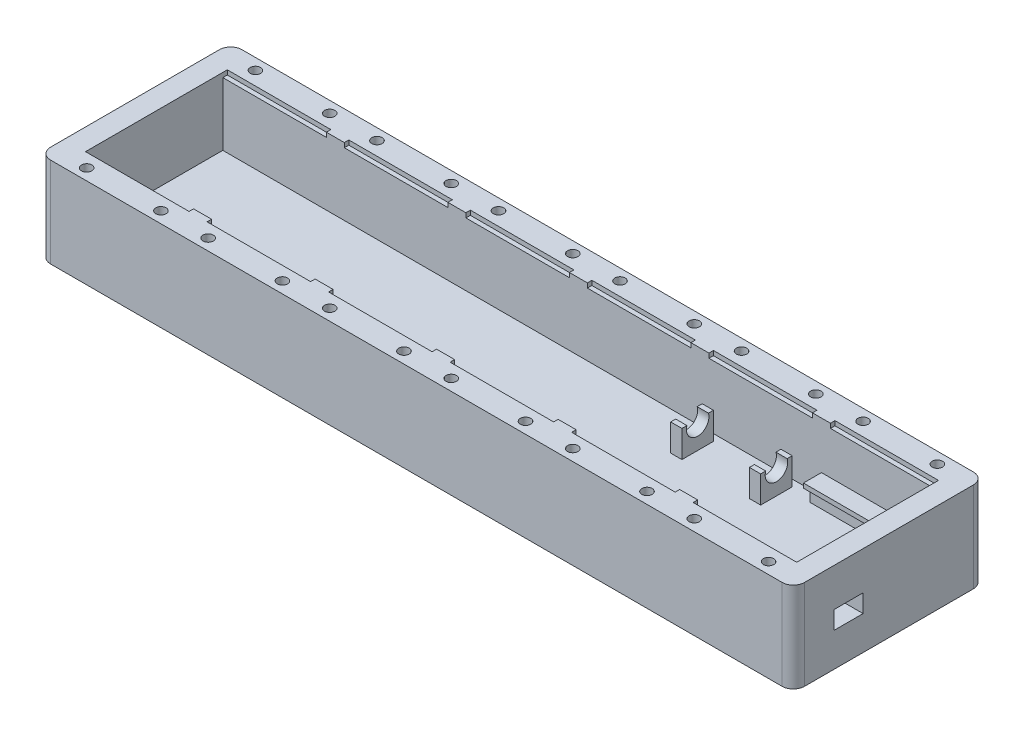
from build123d import *

# Parameters (mm, degrees)
SKIZZE2_W                       = 335
SKIZZE2_H                       = 40
AUFSATZ_LINEAR_AUSTRAGEN1_DEPTH = 85
SKIZZE4_W                       = 316
SKIZZE4_H                       = 59
SCHNITT_LINEAR_AUSTRAGEN1_DEPTH = 30
SKIZZE11_W                      = 46
SKIZZE11_H                      = 2
SCHNITT_LINEAR_AUSTRAGEN4_DEPTH = 2
SKIZZE17_R                      = 2.3
SCHNITT_LINEAR_AUSTRAGEN6_DEPTH = 4
VERRUNDUNG2_R                   = 5
VERRUNDUNG3_R                   = 5
VERRUNDUNG4_R                   = 5
VERRUNDUNG6_R                   = 5
SKIZZE18_W                      = 13
SKIZZE18_H                      = 8
SCHNITT_LINEAR_AUSTRAGEN7_DEPTH = 10
SKIZZE20_W                      = 5
SKIZZE20_H                      = 14
AUFSATZ_LINEAR_AUSTRAGEN2_DEPTH = 12
SKIZZE21_R                      = 5
SCHNITT_LINEAR_AUSTRAGEN8_DEPTH = 71
SKIZZE22_W                      = 50
SKIZZE22_H                      = 9
AUFSATZ_LINEAR_AUSTRAGEN3_DEPTH = 5
SKIZZE23_W                      = 50
SKIZZE23_H                      = 2
AUFSATZ_LINEAR_AUSTRAGEN4_DEPTH = 3


with BuildPart() as part:
    # Skizze2 → Aufsatz-Linear austragen1 (new body)
    with BuildSketch(Plane.XY):
        with Locations((167.5, 20)):
            Rectangle(SKIZZE2_W, SKIZZE2_H)
    extrude(amount=AUFSATZ_LINEAR_AUSTRAGEN1_DEPTH)

    # Skizze4 → Schnitt-Linear austragen1 (cut)
    with BuildSketch(Plane(origin=(0, 40, 0), x_dir=(1, 0, 0), z_dir=(0, 1, 0))):
        with Locations((167.5, -42.5)):
            Rectangle(SKIZZE4_W, SKIZZE4_H)
    extrude(amount=-SCHNITT_LINEAR_AUSTRAGEN1_DEPTH, mode=Mode.SUBTRACT)

    # Skizze11 → Schnitt-Linear austragen4 (cut)
    with BuildSketch(Plane(origin=(0, 40, 0), x_dir=(1, 0, 0), z_dir=(0, 1, 0))):
        with Locations((32.5, -12)):
            Rectangle(SKIZZE11_W, SKIZZE11_H)
        with Locations((32.5, -73)):
            Rectangle(SKIZZE11_W, SKIZZE11_H)
        with Locations((86.5, -73)):
            Rectangle(SKIZZE11_W, SKIZZE11_H)
        with Locations((140.5, -73)):
            Rectangle(SKIZZE11_W, SKIZZE11_H)
        with Locations((194.5, -73)):
            Rectangle(SKIZZE11_W, SKIZZE11_H)
        with Locations((248.5, -73)):
            Rectangle(SKIZZE11_W, SKIZZE11_H)
        with Locations((302.5, -73)):
            Rectangle(SKIZZE11_W, SKIZZE11_H)
        with Locations((302.5, -12)):
            Rectangle(SKIZZE11_W, SKIZZE11_H)
        with Locations((248.5, -12)):
            Rectangle(SKIZZE11_W, SKIZZE11_H)
        with Locations((194.5, -12)):
            Rectangle(SKIZZE11_W, SKIZZE11_H)
        with Locations((140.5, -12)):
            Rectangle(SKIZZE11_W, SKIZZE11_H)
        with Locations((86.5, -12)):
            Rectangle(SKIZZE11_W, SKIZZE11_H)
    extrude(amount=-SCHNITT_LINEAR_AUSTRAGEN4_DEPTH, mode=Mode.SUBTRACT)

    # Skizze17 → Schnitt-Linear austragen6 (cut)
    with BuildSketch(Plane(origin=(0, 40, 0), x_dir=(1, 0, 0), z_dir=(0, 1, 0))):
        with Locations((49, -80)):
            Circle(SKIZZE17_R)
        with Locations((16, -80)):
            Circle(SKIZZE17_R)
        with Locations((16, -5)):
            Circle(SKIZZE17_R)
        with Locations((49, -5)):
            Circle(SKIZZE17_R)
        with Locations((70, -5)):
            Circle(SKIZZE17_R)
        with Locations((103, -5)):
            Circle(SKIZZE17_R)
        with Locations((70, -80)):
            Circle(SKIZZE17_R)
        with Locations((103, -80)):
            Circle(SKIZZE17_R)
        with Locations((124, -80)):
            Circle(SKIZZE17_R)
        with Locations((157, -80)):
            Circle(SKIZZE17_R)
        with Locations((178, -80)):
            Circle(SKIZZE17_R)
        with Locations((211, -80)):
            Circle(SKIZZE17_R)
        with Locations((232, -80)):
            Circle(SKIZZE17_R)
        with Locations((265, -80)):
            Circle(SKIZZE17_R)
        with Locations((286, -80)):
            Circle(SKIZZE17_R)
        with Locations((319, -80)):
            Circle(SKIZZE17_R)
        with Locations((319, -5)):
            Circle(SKIZZE17_R)
        with Locations((286, -5)):
            Circle(SKIZZE17_R)
        with Locations((265, -5)):
            Circle(SKIZZE17_R)
        with Locations((232, -5)):
            Circle(SKIZZE17_R)
        with Locations((211, -5)):
            Circle(SKIZZE17_R)
        with Locations((178, -5)):
            Circle(SKIZZE17_R)
        with Locations((157, -5)):
            Circle(SKIZZE17_R)
        with Locations((124, -5)):
            Circle(SKIZZE17_R)
    extrude(amount=-SCHNITT_LINEAR_AUSTRAGEN6_DEPTH, mode=Mode.SUBTRACT)

    # Verrundung2
    verrundung2_edges = [part.edges().sort_by_distance(p)[0] for p in [
        (0, 20, 85),
    ]]
    fillet(verrundung2_edges, radius=VERRUNDUNG2_R)

    # Verrundung3
    verrundung3_edges = [part.edges().sort_by_distance(p)[0] for p in [
        (0, 20, 0),
    ]]
    fillet(verrundung3_edges, radius=VERRUNDUNG3_R)

    # Verrundung4
    verrundung4_edges = [part.edges().sort_by_distance(p)[0] for p in [
        (335, 20, 0),
    ]]
    fillet(verrundung4_edges, radius=VERRUNDUNG4_R)

    # Verrundung6
    verrundung6_edges = [part.edges().sort_by_distance(p)[0] for p in [
        (335, 20, 85),
    ]]
    fillet(verrundung6_edges, radius=VERRUNDUNG6_R)

    # Skizze18 → Schnitt-Linear austragen7 (cut)
    with BuildSketch(Plane.ZY.offset(-325.5)):
        with Locations((60.5, 19)):
            Rectangle(SKIZZE18_W, SKIZZE18_H)
    extrude(amount=-SCHNITT_LINEAR_AUSTRAGEN7_DEPTH, mode=Mode.SUBTRACT)

    # Skizze20 → Aufsatz-Linear austragen2 (add)
    with BuildSketch(Plane(origin=(0, 10, 0), x_dir=(1, 0, 0), z_dir=(0, 1, 0))):
        with Locations((263, -23)):
            Rectangle(SKIZZE20_W, SKIZZE20_H)
        with Locations((228, -23)):
            Rectangle(SKIZZE20_W, SKIZZE20_H)
    extrude(amount=AUFSATZ_LINEAR_AUSTRAGEN2_DEPTH)

    # Skizze21 → Schnitt-Linear austragen8 (cut)
    with BuildSketch(Plane.ZY.offset(-225.5)):
        with Locations((23, 20.5)):
            Circle(SKIZZE21_R)
    extrude(amount=-SCHNITT_LINEAR_AUSTRAGEN8_DEPTH, mode=Mode.SUBTRACT)

    # Skizze22 → Aufsatz-Linear austragen3 (add)
    with BuildSketch(Plane.XY.offset(13)):
        with Locations((300.5, 14.5)):
            Rectangle(SKIZZE22_W, SKIZZE22_H)
    extrude(amount=AUFSATZ_LINEAR_AUSTRAGEN3_DEPTH)

    # Skizze23 → Aufsatz-Linear austragen4 (add)
    with BuildSketch(Plane.XY.offset(18)):
        with Locations((300.5, 18)):
            Rectangle(SKIZZE23_W, SKIZZE23_H)
    extrude(amount=AUFSATZ_LINEAR_AUSTRAGEN4_DEPTH)


solid = part.part
